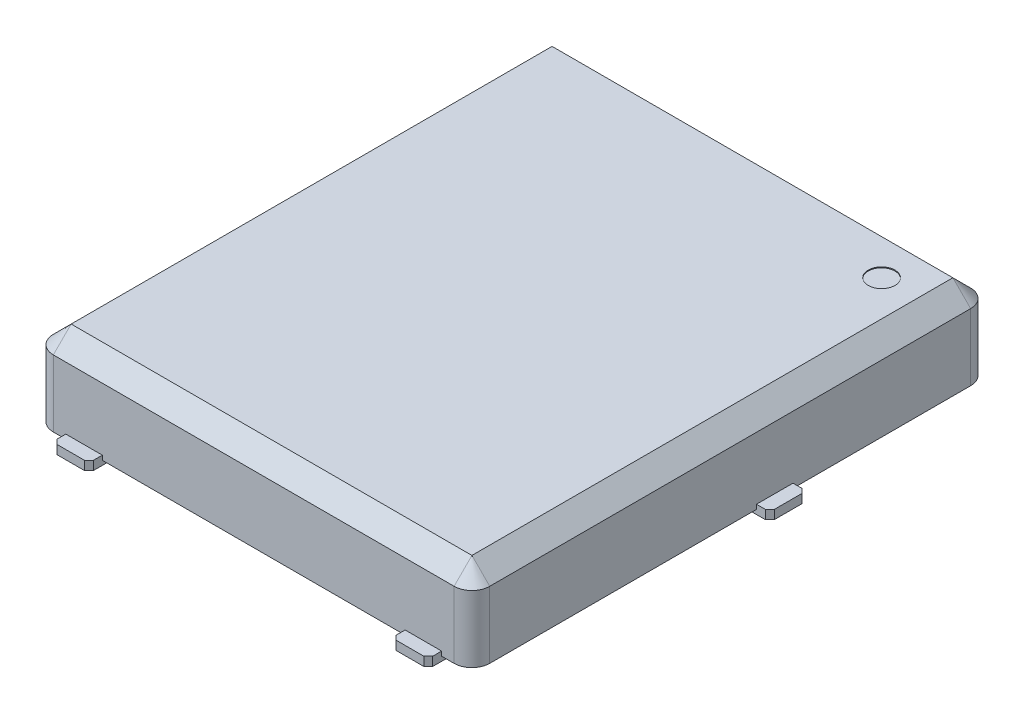
from build123d import *

# Parameters (mm, degrees)
SKETCH_1_W           = 4.9
SKETCH_1_H           = 5.8
EXTRUDE_1_DEPTH      = 0.95
FILLET_1_R           = 0.2
CHAMFER_1_SIZE       = 0.2
EXTRUDE_2_DEPTH      = 0.05
EXTRUDE_2_DEPTH_BACK = 0.05
SKETCH_2_W           = 0.41
SKETCH_2_H           = 0.61
CHAMFER_2_SIZE       = 0.05
EXTRUDE_3_DEPTH      = 0.05
EXTRUDE_3_DEPTH_BACK = 0.05
SKETCH_3_W           = 4.15
SKETCH_3_H           = 3.85
SKETCH_3_W_2         = 0.41
SKETCH_3_H_2         = 0.15
SKETCH_3_W_3         = 0.375
SKETCH_3_H_3         = 0.41
SKETCH_3_W_4         = 0.15
CHAMFER_3_SIZE       = 0.05
SKETCH_4_R           = 0.15
CUT_EXTRUDE_1_DEPTH  = 0.01


with BuildPart() as part:
    # Эскиз1 → Бобышка-Вытянуть1 (new body)
    with BuildSketch(Plane(origin=(0, 0, 0), x_dir=(1, 0, 0), z_dir=(0, 1, 0))):
        Rectangle(SKETCH_1_W, SKETCH_1_H)
    extrude(amount=EXTRUDE_1_DEPTH)

    # Скругление1
    fillet_1_edges = [part.edges().sort_by_distance(p)[0] for p in [
        (2.45, 0.475, 2.9),
        (-2.45, 0.475, 2.9),
        (-2.45, 0.475, -2.9),
        (2.45, 0.475, -2.9),
    ]]
    fillet(fillet_1_edges, radius=FILLET_1_R)

    # Фаска1
    chamfer_1_edges = [part.edges().sort_by_distance(p)[0] for p in [
        (-2.45, 0.95, 0),
        (0, 0.95, -2.9),
        (2.45, 0.95, 0),
        (0, 0.95, 2.9),
        (2.391421356, 0.95, 2.841421356),
        (-2.391421356, 0.95, 2.841421356),
        (2.391421356, 0.95, -2.841421356),
        (-2.391421356, 0.95, -2.841421356),
    ]]
    chamfer(chamfer_1_edges, length=CHAMFER_1_SIZE)

    # Эскиз2 → Бобышка-Вытянуть2 (add, two sides: drawn at the far end of the back side and taken through both)
    with BuildSketch(Plane.XZ.offset(-EXTRUDE_2_DEPTH_BACK)):
        with Locations((0.635, -2.745)):
            Rectangle(SKETCH_2_W, SKETCH_2_H)
        with Locations((1.905, -2.745)):
            Rectangle(SKETCH_2_W, SKETCH_2_H)
        with Locations((-0.635, -2.745)):
            Rectangle(SKETCH_2_W, SKETCH_2_H)
        with Locations((-1.905, -2.745)):
            Rectangle(SKETCH_2_W, SKETCH_2_H)
    extrude(amount=EXTRUDE_2_DEPTH + EXTRUDE_2_DEPTH_BACK)

    # Фаска2
    chamfer_2_edges = [part.edges().sort_by_distance(p)[0] for p in [
        (-2.11, 0, -3.05),
        (-1.7, 0, -3.05),
        (1.7, 0, -3.05),
        (2.11, 0, -3.05),
        (0.43, 0, -3.05),
        (0.84, 0, -3.05),
        (-0.84, 0, -3.05),
        (-0.43, 0, -3.05),
    ]]
    chamfer(chamfer_2_edges, length=CHAMFER_2_SIZE)

    # Эскиз3 → Бобышка-Вытянуть3 (add, two sides: drawn at the far end of the back side and taken through both)
    with BuildSketch(Plane.XZ.offset(-EXTRUDE_3_DEPTH_BACK)):
        with Locations((0, 0.685)):
            Rectangle(SKETCH_3_W, SKETCH_3_H)
        with Locations((1.905, 2.975)):
            Rectangle(SKETCH_3_W_2, SKETCH_3_H_2)
        Polygon((1.7, 2.61), (2.075, 2.61), (2.11, 2.61), (2.11, 2.9), (1.7, 2.9), align=None)
        with Locations((-1.905, 2.975)):
            Rectangle(SKETCH_3_W_2, SKETCH_3_H_2)
        Polygon((-2.11, 2.61), (-2.075, 2.61), (-1.7, 2.61), (-1.7, 2.9), (-2.11, 2.9), align=None)
        with Locations((2.2625, -0.5)):
            Rectangle(SKETCH_3_W_3, SKETCH_3_H_3)
        with Locations((2.525, -0.5)):
            Rectangle(SKETCH_3_W_4, SKETCH_3_H_3)
        with Locations((-2.2625, -0.5)):
            Rectangle(SKETCH_3_W_3, SKETCH_3_H_3)
        with Locations((-2.525, -0.5)):
            Rectangle(SKETCH_3_W_4, SKETCH_3_H_3)
    extrude(amount=EXTRUDE_3_DEPTH + EXTRUDE_3_DEPTH_BACK)

    # Фаска3
    # the kernel refuses this chamfer: 0.05 mm, written as the material it adds along each edge
    with BuildSketch(Plane(origin=(-1.7, -0.05, 2.61), x_dir=(-0.02749587661058742, 0, 0.9996219169112966), z_dir=(0, 1, 0)), Plane(origin=(1.7, -0.05, 2.61), x_dir=(-0.9996219169112966, 0, -0.02749587661058718), z_dir=(0, 1, 0))) as chamfer_3_piece_1:
        Polygon((CHAMFER_3_SIZE * 0.999621916911, CHAMFER_3_SIZE * 0.0274958766106), (-CHAMFER_3_SIZE * 0.0274958766106, CHAMFER_3_SIZE * 0.999621916911), (0, 0), align=None)
    extrude(amount=0.178584149)
    # the kernel refuses this chamfer: 0.05 mm, written as the material it takes off along each edge
    with BuildSketch(Plane(origin=(-2.6, -0.178584149, -0.295), x_dir=(0.9996219169112966, 0, 0.02749587661058634), z_dir=(0, 1, 0)), Plane(origin=(2.6, -0.178584149, -0.705), x_dir=(-0.9996219169112965, 0, -0.027495876610591732), z_dir=(0, 1, 0)), Plane(origin=(2.6, -0.178584149, -0.295), x_dir=(0.02749587661058736, 0, -0.9996219169112966), z_dir=(0, 1, 0))) as chamfer_3_2_piece_1:
        Polygon((CHAMFER_3_SIZE * 0.999621916911, CHAMFER_3_SIZE * 0.0274958766106), (-CHAMFER_3_SIZE * 0.0274958766106, CHAMFER_3_SIZE * 0.999621916911), (0, 0), align=None)
    extrude(amount=0.357168299, mode=Mode.SUBTRACT)
    with BuildSketch(Plane(origin=(-2.11, -0.178584149, 2.61), x_dir=(-0.02749587661058742, 0, 0.9996219169112966), z_dir=(0, 1, 0))) as chamfer_3_2_piece_2_section:
        Polygon((CHAMFER_3_SIZE * 0.999621916911, CHAMFER_3_SIZE * 0.0274958766106), (-CHAMFER_3_SIZE * 0.0274958766106, CHAMFER_3_SIZE * 0.999621916911), (0, 0), align=None)
    chamfer_3_2_piece_2 = extrude(amount=0.178584149, mode=Mode.PRIVATE)
    chamfer_3_2_piece_2 = split(chamfer_3_2_piece_2, bisect_by=Plane(origin=(-2.075, -0.025, 2.627820513), z_dir=(-1, 0, 0)), keep=Keep.TOP, mode=Mode.PRIVATE)
    add(chamfer_3_2_piece_2, mode=Mode.SUBTRACT)
    with BuildSketch(Plane(origin=(-1.7, -0.178584149, 3.05), x_dir=(-0.9996219169112966, 0, 0.027495876610587302), z_dir=(0, 1, 0)), Plane(origin=(2.11, -0.178584149, 3.05), x_dir=(-0.9996219169112966, 0, 0.02749587661058742), z_dir=(0, 1, 0)), Plane(origin=(-2.6, -0.178584149, -0.705), x_dir=(0.9996219169112966, 0, -0.02749587661058742), z_dir=(0, 1, 0)), Plane(origin=(-2.11, -0.178584149, 3.05), x_dir=(-0.02749587661058742, 0, -0.9996219169112966), z_dir=(0, 1, 0)), Plane(origin=(1.7, -0.178584149, 3.05), x_dir=(-0.027495876610591732, 0, -0.9996219169112965), z_dir=(0, 1, 0))) as chamfer_3_2_piece_3:
        Polygon((CHAMFER_3_SIZE * 0.999621916911, -CHAMFER_3_SIZE * 0.0274958766106), (-CHAMFER_3_SIZE * 0.0274958766106, -CHAMFER_3_SIZE * 0.999621916911), (0, 0), align=None)
    extrude(amount=0.357168299, mode=Mode.SUBTRACT)
    with BuildSketch(Plane(origin=(2.11, -0.178584149, 2.61), x_dir=(0.02749587661058742, 0, 0.9996219169112966), z_dir=(0, 1, 0))) as chamfer_3_2_piece_4_section:
        Polygon((CHAMFER_3_SIZE * 0.999621916911, -CHAMFER_3_SIZE * 0.0274958766106), (-CHAMFER_3_SIZE * 0.0274958766106, -CHAMFER_3_SIZE * 0.999621916911), (0, 0), align=None)
    chamfer_3_2_piece_4 = extrude(amount=0.178584149, mode=Mode.PRIVATE)
    chamfer_3_2_piece_4 = split(chamfer_3_2_piece_4, bisect_by=Plane(origin=(2.075, -0.025, 2.627820513), z_dir=(1, 0, 0)), keep=Keep.TOP, mode=Mode.PRIVATE)
    add(chamfer_3_2_piece_4, mode=Mode.SUBTRACT)

    # Эскиз4 → Вырез-Вытянуть1 (cut)
    with BuildSketch(Plane(origin=(0, 0.95, 0), x_dir=(1, 0, 0), z_dir=(0, 1, 0))):
        with Locations(Location((1.85, 2.3, 0), (0, 0, 270))):
            Circle(SKETCH_4_R)
    extrude(amount=-CUT_EXTRUDE_1_DEPTH, mode=Mode.SUBTRACT)


solid = part.part
